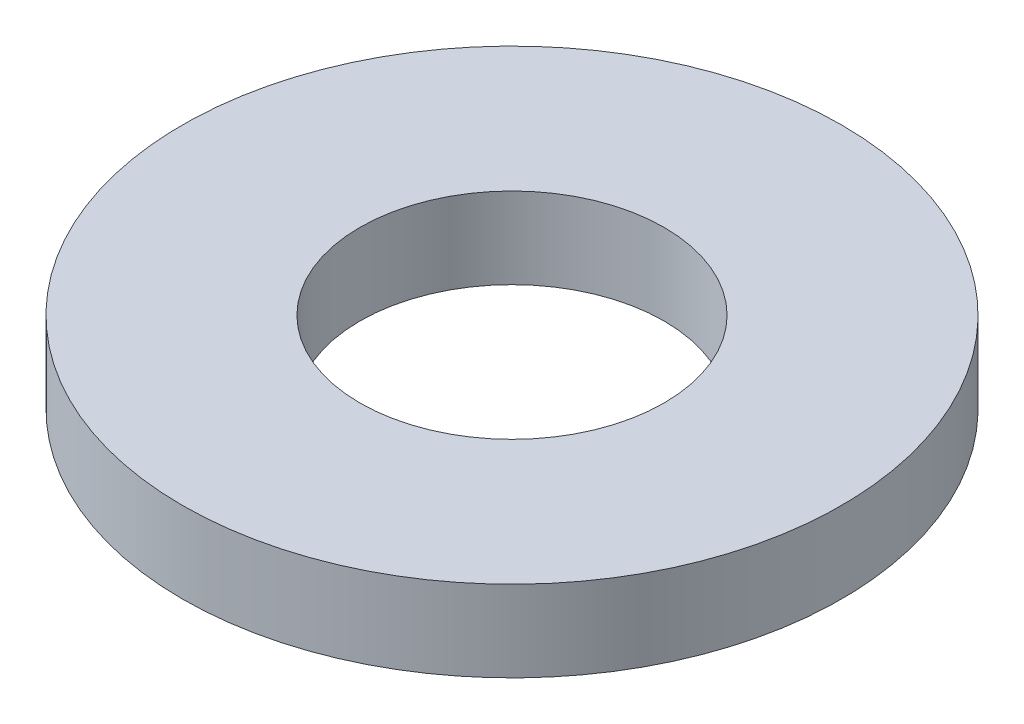
from build123d import *

# Parameters (mm, degrees)
SKETCH1_R           = 65
BOSS_EXTRUDE1_DEPTH = 16
SKETCH2_R           = 30
CUT_EXTRUDE1_DEPTH  = 94.305948363


with BuildPart() as part:
    # Sketch1 → Boss-Extrude1 (new body)
    with BuildSketch(Plane(origin=(0, 0, 0), x_dir=(1, 0, 0), z_dir=(0, 1, 0))):
        Circle(SKETCH1_R)
    extrude(amount=BOSS_EXTRUDE1_DEPTH)

    # Sketch2 → Cut-Extrude1 (cut, through all)
    with BuildSketch(Plane(origin=(0, 0, 0), x_dir=(1, 0, 0), z_dir=(0, 1, 0))):
        Circle(SKETCH2_R)
    extrude(amount=CUT_EXTRUDE1_DEPTH, mode=Mode.SUBTRACT)


solid = part.part
